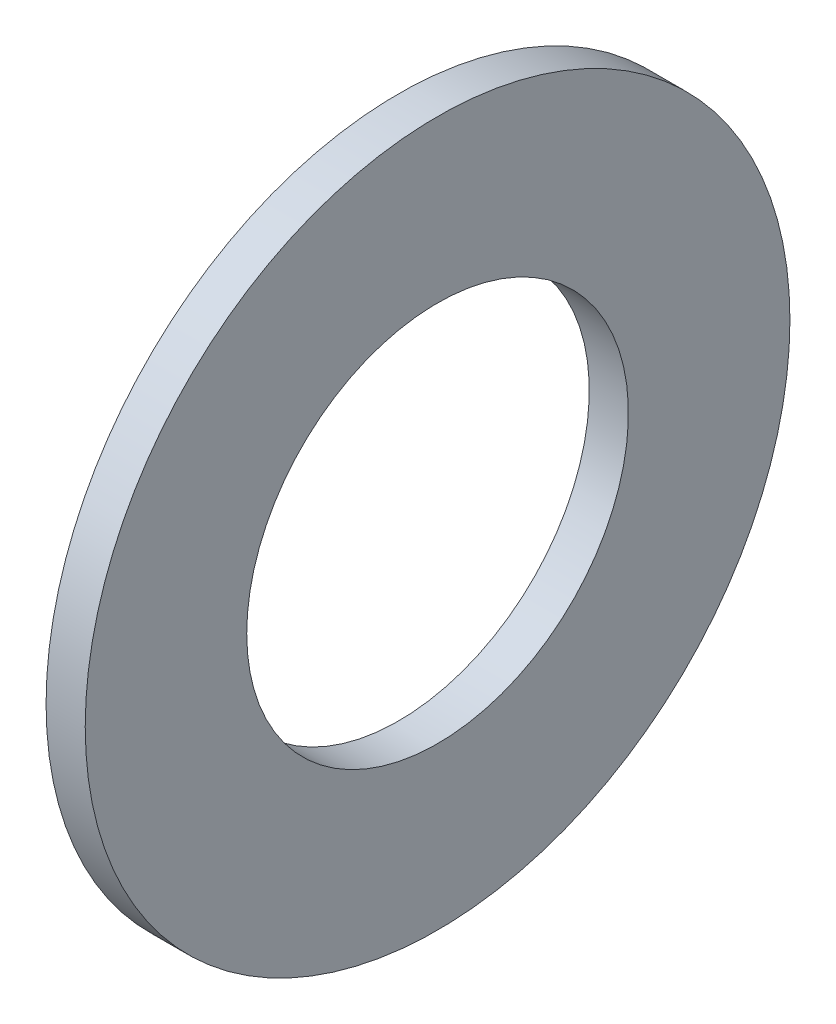
from build123d import *

# Parameters (mm, degrees)
SKETCH1_W = 4
SKETCH1_H = 16.5


with BuildPart() as part:
    # Sketch1 → Base-Revolve (revolve)
    with BuildSketch(Plane.XY):
        with Locations((-2, 27.75)):
            Rectangle(SKETCH1_W, SKETCH1_H)
    revolve(axis=Axis((-34.925, 0, 0), (1, 0, 0)))


solid = part.part
